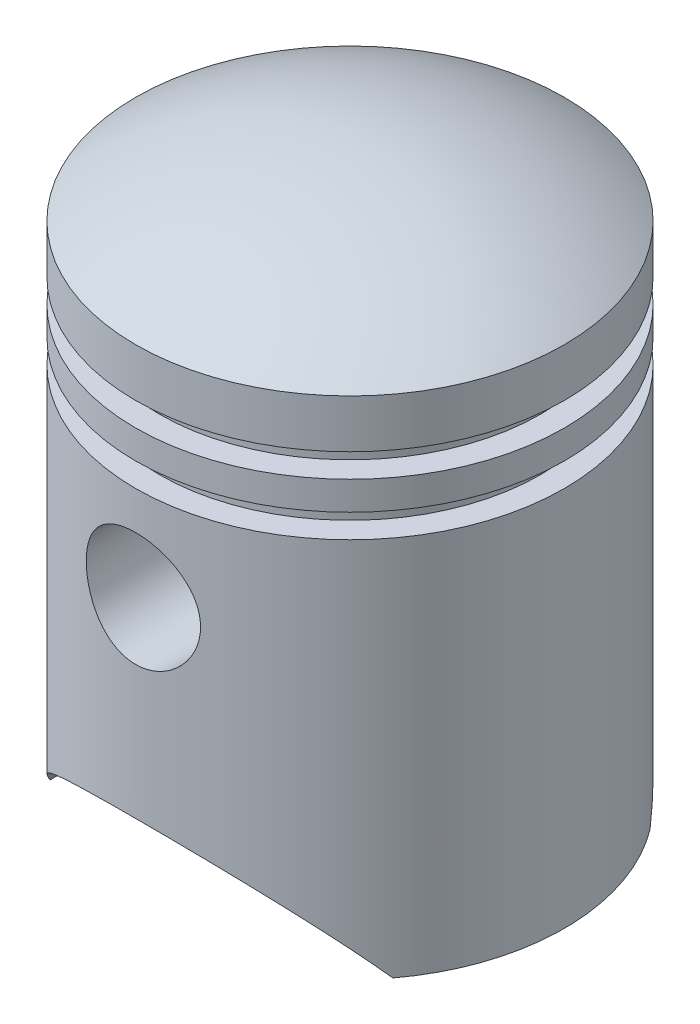
from build123d import *

# Parameters (mm, degrees)
SZKIC2_W                         = 2.5
SZKIC2_H                         = 2.5
SZYK_LINIOWY1_COUNT              = 2
SZYK_LINIOWY1_PITCH              = 5.5
WYTNIJ_WYCI_GNI_CIE2_DEPTH       = 68.915388536
WYTNIJ_WYCI_GNI_CIE2_DEPTH_BACK  = 68.915388536
WYTNIJ_WYCI_GNI_CIE3_DEPTH       = 68.915388602
WYTNIJ_WYCI_GNI_CIE3_DEPTH_BACK  = 68.915388602
SZKIC4_R                         = 6
DODANIE_WYCI_GNI_CIE1_REACH      = 79.915
DODANIE_WYCI_GNI_CIE1_END_RADIUS = 20.5
DODANIE_WYCI_GNI_CIE1_START      = 10
SZKIC5_R                         = 7.5
SZKIC5_R_2                       = 6


# Read off the part's stored shape, not the designer's step: Skorupa1
with BuildPart() as part:
    # Szkic1 → Obrót1 (revolve)
    with BuildSketch(Plane.XY):
        with BuildLine():
            Line((0, 0), (0, 60))
            ThreePointArc((0, 60), (11.771243445, 58.228756555), (22.5, 53.071891388))
            Line((22.5, 53.071891388), (22.5, 0))
            Line((22.5, 0), (0, 0))
        make_face()
    revolve(axis=Axis((0, 0, 0), (0, 1, 0)))

    # Szkic2 → Wycięcie-obrót1 (revolve, cut)
    with BuildSketch(Plane.XY, mode=Mode.PRIVATE) as wyci_cie_obr_t1_sk:
        with Locations((21.25, 41.25)):
            Rectangle(SZKIC2_W, SZKIC2_H)
    wyci_cie_obr_t1 = revolve(wyci_cie_obr_t1_sk.sketch.rotate(Axis((0, 0, 0), (0, 1, 0)), 90), axis=Axis((0, 0, 0), (0, 1, 0)), mode=Mode.SUBTRACT)

    # Szyk liniowy1: Wycięcie-obrót1 ×2
    with Locations(*[(0, i * SZYK_LINIOWY1_PITCH, 0) for i in range(1, SZYK_LINIOWY1_COUNT)]):
        add(wyci_cie_obr_t1, mode=Mode.SUBTRACT)

    # Skorupa1 outline → Skorupa1 (revolve, cut)
    with BuildSketch(Plane.XY):
        with BuildLine():
            ThreePointArc((20.500000011, 51.996093505), (10.680553516, 56.468147425), (0, 58))
            Line((0, 58), (0, 0))
            Line((0, 0), (20.5, 0))
            Line((20.5, 0), (20.5, 38))
            Line((20.5, 38), (18, 38))
            Line((18, 38), (18, 50))
            Line((18, 50), (20.5, 50))
            Line((20.5, 50), (20.500000011, 51.996093505))
        make_face()
    revolve(axis=Axis((0, 0, 0), (0, 1, 0)), mode=Mode.SUBTRACT)

    # Szkic3 → Wytnij-wyciągnięcie2 (cut, two sides: drawn at the far end of the back side and taken through both)
    with BuildSketch(Plane.XY.offset(-WYTNIJ_WYCI_GNI_CIE2_DEPTH_BACK)):
        with BuildLine():
            Line((-99.770112831, -131.416252764), (-18, 0))
            ThreePointArc((-18, 0), (0, 10), (18, 0))
            Line((18, 0), (99.770112831, -131.416252764))
            Line((99.770112831, -131.416252764), (99.770112831, -440.974537052))
            Line((99.770112831, -440.974537052), (-99.770112831, -440.974537052))
            Line((-99.770112831, -440.974537052), (-99.770112831, -131.416252764))
        make_face()
    extrude(amount=WYTNIJ_WYCI_GNI_CIE2_DEPTH + WYTNIJ_WYCI_GNI_CIE2_DEPTH_BACK, mode=Mode.SUBTRACT)

    # Szkic4 → Wytnij-wyciągnięcie3 (cut, two sides: drawn at the far end of the back side and taken through both)
    with BuildSketch(Plane.XY.offset(-WYTNIJ_WYCI_GNI_CIE3_DEPTH_BACK)):
        with Locations((0, 30)):
            Circle(SZKIC4_R)
    extrude(amount=WYTNIJ_WYCI_GNI_CIE3_DEPTH + WYTNIJ_WYCI_GNI_CIE3_DEPTH_BACK, mode=Mode.SUBTRACT)

    # Dodanie-wyciągnięcie1: up to this cylinder (the profile starts inside it)
    dodanie_wyci_gni_cie1_end = Plane(origin=(0, 30, 0), z_dir=(0, -1, 0)) * Cylinder(DODANIE_WYCI_GNI_CIE1_END_RADIUS, 201.83, mode=Mode.PRIVATE)
    # Szkic5 → Dodanie-wyciągnięcie1 (add, up to the surface)
    with BuildSketch(Plane.XY.offset(DODANIE_WYCI_GNI_CIE1_START), mode=Mode.PRIVATE) as dodanie_wyci_gni_cie1_sk1:
        with Locations(Location((0, 30, 0), (0, 0, 180))):
            Circle(SZKIC5_R)
        with Locations((0, 30)):
            Circle(SZKIC5_R_2, mode=Mode.SUBTRACT)
    dodanie_wyci_gni_cie1_tool1 = extrude(dodanie_wyci_gni_cie1_sk1.sketch, amount=DODANIE_WYCI_GNI_CIE1_REACH, mode=Mode.PRIVATE) & dodanie_wyci_gni_cie1_end
    dodanie_wyci_gni_cie1 = dodanie_wyci_gni_cie1_tool1.solids().sort_by_distance((7.287868, 30, 10))[0]
    add(dodanie_wyci_gni_cie1)

    # Lustro1: Dodanie-wyciągnięcie1 across plane
    add(dodanie_wyci_gni_cie1.mirror(Plane.XY))


solid = part.part
